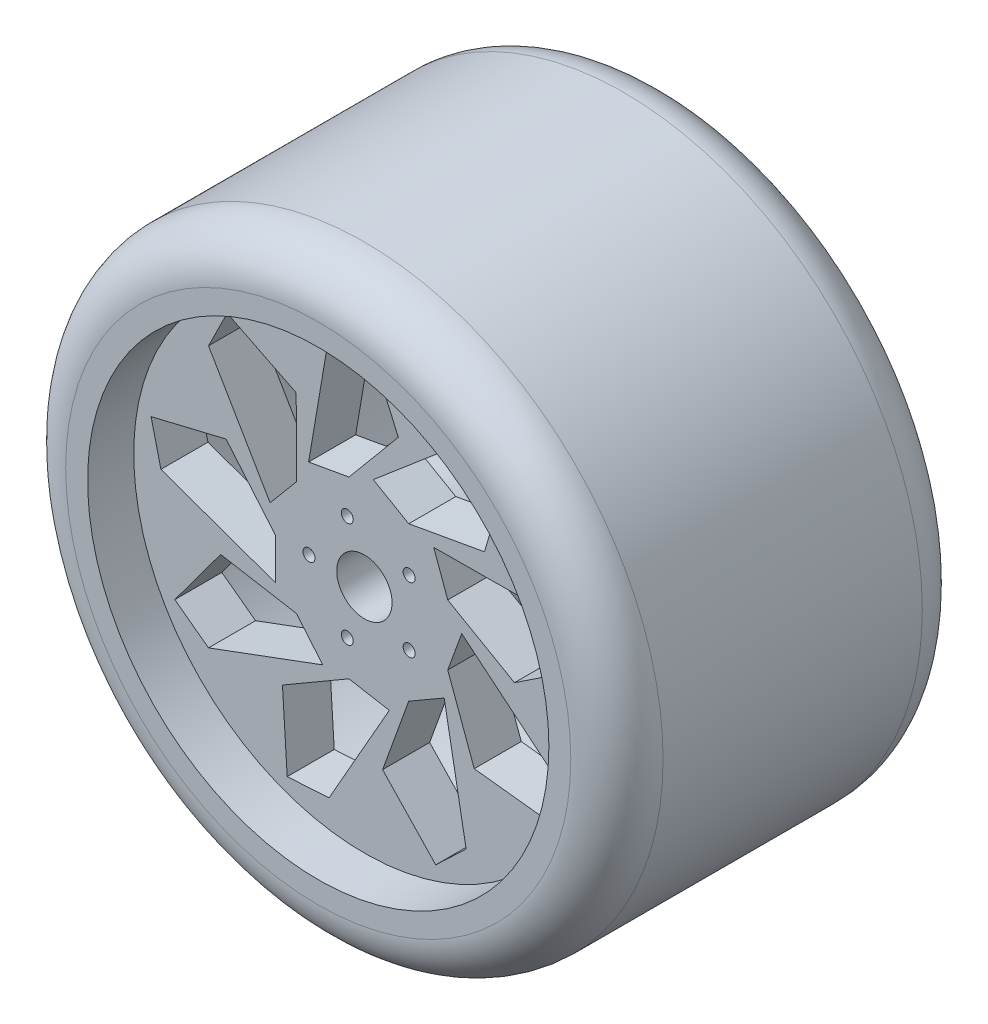
from build123d import *

# Parameters (mm, degrees)
SZKIC1_R                    = 323.75
DODANIE_WYCI_GNI_CIE1_DEPTH = 381
ZAOKR_GLENIE1_R             = 50
SZKIC2_R                    = 6.5
SZKIC2_R_2                  = 30
WYTNIJ_WYCI_GNI_CIE1_DEPTH  = 596.641775734
SZKIC3_R                    = 250
WYTNIJ_WYCI_GNI_CIE2_DEPTH  = 50
WYTNIJ_WYCI_GNI_CIE3_START  = -200
SZKIC4_R                    = 250
WYTNIJ_WYCI_GNI_CIE3_DEPTH  = 200
WYTNIJ_WYCI_GNI_CIE4_DEPTH  = 200
WYTNIJ_WYCI_GNI_CIE5_START  = -80
SZKIC6_R                    = 250
SZKIC6_R_2                  = 85
WYTNIJ_WYCI_GNI_CIE5_DEPTH  = 80


with BuildPart() as part:
    # Szkic1 → Dodanie-wyciągnięcie1 (new body)
    with BuildSketch(Plane.XY):
        Circle(SZKIC1_R)
    extrude(amount=DODANIE_WYCI_GNI_CIE1_DEPTH)

    # Zaokrąglenie1
    zaokr_glenie1_edges = [part.edges().sort_by_distance(p)[0] for p in [
        (-323.75, 0, 0),
        (-323.75, 0, 381),
    ]]
    fillet(zaokr_glenie1_edges, radius=ZAOKR_GLENIE1_R)

    # Szkic2 → Wytnij-wyciągnięcie1 (cut, through all)
    with BuildSketch(Plane.XY.offset(381)):
        with Locations((-60, 0)):
            Circle(SZKIC2_R)
        with Locations((-18.541019662, 57.063390978)):
            Circle(SZKIC2_R)
        with Locations((48.541019662, 35.267115138)):
            Circle(SZKIC2_R)
        with Locations((48.541019662, -35.267115138)):
            Circle(SZKIC2_R)
        with Locations((-18.541019662, -57.063390978)):
            Circle(SZKIC2_R)
        Circle(SZKIC2_R_2)
    extrude(amount=-WYTNIJ_WYCI_GNI_CIE1_DEPTH, mode=Mode.SUBTRACT)

    # Szkic3 → Wytnij-wyciągnięcie2 (cut)
    with BuildSketch(Plane.XY.offset(381)):
        Circle(SZKIC3_R)
    extrude(amount=-WYTNIJ_WYCI_GNI_CIE2_DEPTH, mode=Mode.SUBTRACT)

    # Szkic4 → Wytnij-wyciągnięcie3 (cut)
    with BuildSketch(Plane(origin=(0, 0, 0), x_dir=(-1, 0, 0), z_dir=(0, 0, -1)).offset(WYTNIJ_WYCI_GNI_CIE3_START)):
        Circle(SZKIC4_R)
    extrude(amount=WYTNIJ_WYCI_GNI_CIE3_DEPTH, mode=Mode.SUBTRACT)

    # Szkic5 → Wytnij-wyciągnięcie4 (cut)
    with BuildSketch(Plane.XY.offset(331)):
        Polygon((-96.155840105, 0), (-149.925673453, 63.746040452), (-231.191444309, 44.19337378), (-220.558452121, 0), (-96.155840105, -44.404647078), align=None)
        Polygon((-102.20240394, 27.791849476), (-73.659646986, 61.807782618), (-73.87456406, 145.202665329), (-148.695968113, 182.461084274), (-168.95757663, 141.772240235), align=None)
        Polygon((-60.427327118, 86.984230788), (-16.697286406, 94.695016833), (36.743274881, 158.71734935), (3.376004134, 235.353225607), (-38.29957328, 217.207673641), align=None)
        Polygon((9.622367637, 105.475723792), (48.077920052, 83.273400253), (130.168527149, 97.966421664), (153.868306527, 178.120977019), (110.279226061, 191.009222556), align=None)
        Polygon((75.169649634, 74.613953402), (90.356933392, 32.887234214), (162.686478902, -8.624083495), (232.36391824, 37.543943689), (207.25714991, 75.435433406), align=None)
        Polygon((105.54421715, 8.839484973), (90.356933392, -32.887234214), (119.081619118, -111.17928414), (202.133870171, -120.600318147), (207.25714991, -75.435433406), align=None)
        Polygon((86.533472468, -61.071076714), (48.077920052, -83.273400253), (19.757146304, -161.712462116), (77.323137782, -222.314350799), (110.279226061, -191.009222556), align=None)
        Polygon((27.032754306, -102.405802878), (-16.697286406, -94.695016833), (-88.811914842, -136.578581834), (-83.667950127, -220.005027963), (-38.29957328, -217.207673641), align=None)
        Polygon((-45.116890032, -95.823715761), (-73.659646986, -61.807782618), (-155.824893999, -47.53806521), (-205.509874305, -114.75290746), (-168.95757663, -141.772240235), align=None)
    extrude(amount=-WYTNIJ_WYCI_GNI_CIE4_DEPTH, mode=Mode.SUBTRACT)

    # Szkic6 → Wytnij-wyciągnięcie5 (cut)
    with BuildSketch(Plane(origin=(0, 0, 200), x_dir=(-1, 0, 0), z_dir=(0, 0, -1)).offset(WYTNIJ_WYCI_GNI_CIE5_START)):
        Circle(SZKIC6_R)
        Circle(SZKIC6_R_2, mode=Mode.SUBTRACT)
    extrude(amount=WYTNIJ_WYCI_GNI_CIE5_DEPTH, mode=Mode.SUBTRACT)


solid = part.part
